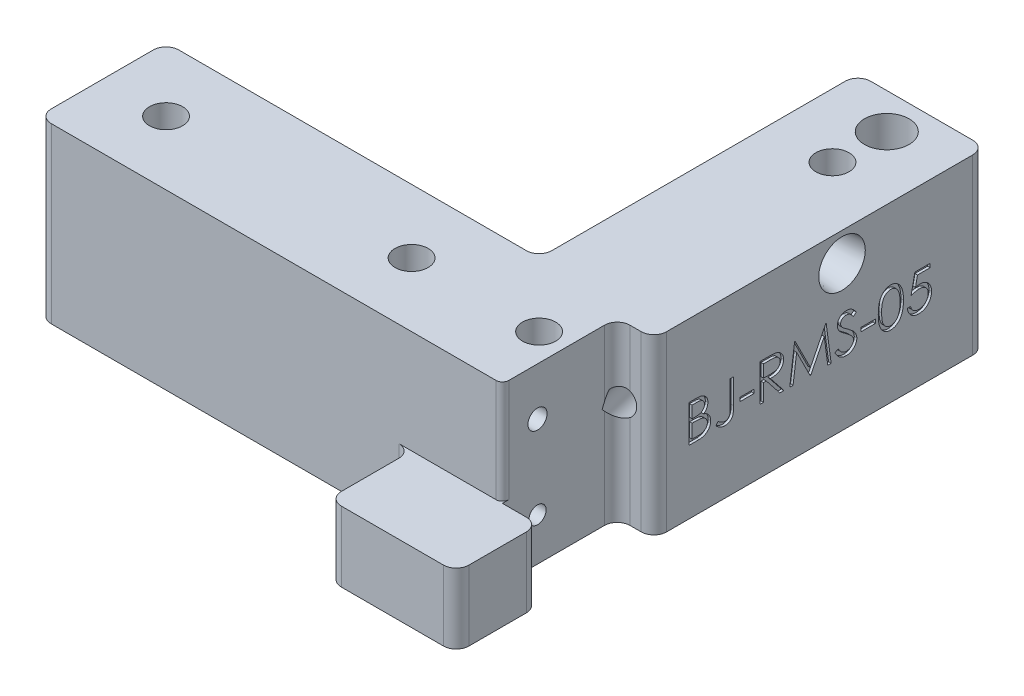
from build123d import *

# Parameters (mm, degrees)
SKETCH1_R                        = 2.6
BOSS_EXTRUDE1_DEPTH              = 10
SKETCH4_R                        = 2.6
MOTOR_TENSIONING_HOLE_DEPTH      = 106.651549918
SKETCH10_W                       = 20
SKETCH10_H                       = 13
BOSS_EXTRUDE3_DEPTH              = 10
FILLET1_R                        = 2
CHAMFER2_SIZE                    = 12
CHAMFER2_SIZE2                   = 1.049863962
SKETCH6_R                        = 3.5
CUT_EXTRUDE1_DEPTH               = 5
SKETCH2_R                        = 2.6
HEIGHT_BUMP_DEPTH                = 10.2
SKETCH12_W                       = 18
SKETCH12_H                       = 20.2
LIMIT_SWITCH_CUTOUT_DEPTH        = 5.75
SKETCH8_W                        = 2.238782052
SKETCH8_H                        = 0.597008547
SKETCH8_W_2                      = 2.238782051
RIGHT_SIDE_PART_NUM_SHORT_DEPTH  = 0.4
SKETCH11_W                       = 22.169940191
SKETCH11_H                       = 13
CUT_EXTRUDE4_DEPTH               = 12.2
FILLET2_R                        = 2
FILLET3_R                        = 1
MOVE_FACE2_BY                    = 7
CUT_EXTRUDE8_DEPTH               = 4
CUT_SWEEP1_START                 = 17.571186692
CUT_SWEEP1_OUTLINE_R             = 2
CUT_SWEEP1_DEPTH                 = 38.261414041
SKETCH22_R                       = 1.5
SKETCH22_R_2                     = 1.35
D2HW_LIMIT_SWITCH_MOUNTING_DEPTH = 7


# Read off the part's stored shape, not the designer's step: Cut-Sweep1
with BuildPart() as part:
    # Sketch1 → Boss-Extrude1 (new body)
    with BuildSketch(Plane(origin=(0, 0, 0), x_dir=(1, 0, 0), z_dir=(0, 1, 0))):
        Polygon((0, 0), (78.5, 0), (78.5, 20), (20, 20), (20, 70), (0, 70), align=None)
        with Locations(Location((10, 56, 0), (0, 0, 270))):
            Circle(SKETCH1_R, mode=Mode.SUBTRACT)
        with Locations(Location((68.5, 10, 0), (0, 0, 270))):
            Circle(SKETCH1_R, mode=Mode.SUBTRACT)
        with Locations(Location((10, 10, 0), (0, 0, 270))):
            Circle(SKETCH1_R, mode=Mode.SUBTRACT)
        with Locations(Location((30, 10, 0), (0, 0, 270))):
            Circle(SKETCH1_R, mode=Mode.SUBTRACT)
    extrude(amount=BOSS_EXTRUDE1_DEPTH)

    # Sketch4 → motor tensioning hole (cut, through all)
    with BuildSketch(Plane.ZY):
        with Locations((-47.5, 5.5)):
            Circle(SKETCH4_R)
    extrude(amount=-MOTOR_TENSIONING_HOLE_DEPTH, mode=Mode.SUBTRACT)

    # Sketch10 → Boss-Extrude3 (add)
    with BuildSketch(Plane(origin=(0, 10, 0), x_dir=(1, 0, 0), z_dir=(0, 1, 0))):
        with Locations((10, -6.5)):
            Rectangle(SKETCH10_W, SKETCH10_H)
    extrude(amount=-BOSS_EXTRUDE3_DEPTH)

    # Fillet1
    fillet1_edges = [part.edges().sort_by_distance(p)[0] for p in [
        (0, 5, -70),
        (20, 5, -70),
        (20, 5, -20),
        (78.5, 5, -20),
        (78.5, 5, 0),
        (0, 5, 13),
        (20, 5, 0),
        (20, 5, 13),
    ]]
    fillet(fillet1_edges, radius=FILLET1_R)

    # Chamfer2
    chamfer2_edges = [part.edges().sort_by_distance(p)[0] for p in [
        (0, 5.5, -50.1),
    ]]
    chamfer2_side = [part.faces().sort_by_distance(p)[0] for p in [
        (10, 5.5, -50.1),
    ]]
    chamfer(chamfer2_edges, length=CHAMFER2_SIZE, length2=CHAMFER2_SIZE2, reference=chamfer2_side[0])

    # Sketch6 → Cut-Extrude1 (cut)
    with BuildSketch(Plane(origin=(0, 10, 0), x_dir=(1, 0, 0), z_dir=(0, 1, 0))):
        with Locations(Location((9.89945477, 64.41665231, 0), (0, 0, 270))):
            Circle(SKETCH6_R)
    extrude(amount=-CUT_EXTRUDE1_DEPTH, mode=Mode.SUBTRACT)


with BuildPart() as body_2:
    # Mirror1: mirrored copy
    add(part.part.mirror(Plane(origin=(78.5, 10, 0), x_dir=(0, 0, 1), z_dir=(-1, 0, 0))))

    # Sketch2 → height bump (add)
    with BuildSketch(Plane(origin=(0, 0, 0), x_dir=(1, 0, 0), z_dir=(0, 1, 0))):
        with BuildLine():
            Line((157, -11), (157, 68))
            ThreePointArc((157, 68), (156.414213562, 69.414213562), (155, 70))
            Line((155, 70), (139, 70))
            ThreePointArc((139, 70), (137.585786438, 69.414213562), (137, 68))
            Line((137, 68), (137, 22))
            ThreePointArc((137, 22), (136.414213562, 20.585786438), (135, 20))
            Line((135, 20), (80.5, 20))
            ThreePointArc((80.5, 20), (79.085786438, 19.414213562), (78.5, 18))
            Line((78.5, 18), (78.5, 2))
            ThreePointArc((78.5, 2), (79.085786438, 0.585786438), (80.5, 0))
            Line((80.5, 0), (135, 0))
            ThreePointArc((135, 0), (136.414213562, -0.585786438), (137, -2))
            Line((137, -2), (137, -11))
            ThreePointArc((137, -11), (137.585786438, -12.414213562), (139, -13))
            Line((139, -13), (155, -13))
            ThreePointArc((155, -13), (156.414213562, -12.414213562), (157, -11))
        make_face()
        with Locations(Location((147, 56, 0), (0, 0, 270))):
            Circle(SKETCH2_R, mode=Mode.SUBTRACT)
        with Locations(Location((147, 10, 0), (0, 0, 270))):
            Circle(SKETCH2_R, mode=Mode.SUBTRACT)
        with Locations(Location((88.5, 10, 0), (0, 0, 270))):
            Circle(SKETCH2_R, mode=Mode.SUBTRACT)
        with Locations(Location((127, 10, 0), (0, 0, 270))):
            Circle(SKETCH2_R, mode=Mode.SUBTRACT)
    extrude(amount=-HEIGHT_BUMP_DEPTH)

    # Sketch12 → Limit Switch Cutout (cut)
    with BuildSketch(Plane(origin=(157, 0, 0), x_dir=(0, 0, -1), z_dir=(1, 0, 0))):
        with Locations((9, -0.1)):
            Rectangle(SKETCH12_W, SKETCH12_H)
    extrude(amount=-LIMIT_SWITCH_CUTOUT_DEPTH, mode=Mode.SUBTRACT)

    # Sketch8 → Right Side Part Num Short (cut)
    # profile 1 of 9: a face of its own
    with BuildSketch(Plane(origin=(157, 0, 0), x_dir=(0, 0, -1), z_dir=(1, 0, 0))):
        with BuildLine():
            Line((23.479347008, -1.379166667), (24.615062486, -1.379166667))
            add(Edge.make_bspline(
                [(24.615062486, -1.379166667), (24.670657229, -1.379458956), (24.778413677, -1.380025486), (24.935109582, -1.388811837), (25.081875759, -1.400792226), (25.218754771, -1.419801558), (25.345683367, -1.442738597), (25.463044069, -1.470515308), (25.570463677, -1.503821474), (25.698709501, -1.556784873), (25.844929934, -1.635487809), (26.003253927, -1.751785672), (26.13863693, -1.894034304), (26.25536346, -2.054494149), (26.348166037, -2.231008046), (26.415304023, -2.419368863), (26.457809204, -2.617147046), (26.46218054, -2.752927426), (26.464389743, -2.821548644)],
                knots=[0, 0, 0, 0, 1.001505555, 1.941167018, 2.826882275, 3.653841531, 4.429895133, 5.150066043, 5.825578002, 6.45369114, 7.647487171, 8.808567382, 9.977351308, 11.170798116, 12.373658725, 13.556498008, 14.765093433, 16, 16, 16, 16], degree=3))
            add(Edge.make_bspline(
                [(26.464389743, -2.821548644), (26.462571617, -2.885831526), (26.458998827, -3.01215345), (26.424834262, -3.196913534), (26.371348007, -3.372787882), (26.29699892, -3.539134635), (26.200369767, -3.692195299), (26.085851825, -3.833204597), (25.94768719, -3.956192248), (25.844170754, -4.024949432), (25.791589095, -4.059874967)],
                knots=[0, 0, 0, 0, 1.044552857, 2.05264487, 3.044412934, 4.028983338, 5.005914585, 5.980388656, 6.974128949, 8, 8, 8, 8], degree=3))
            add(Edge.make_bspline(
                [(25.791589095, -4.059874967), (25.857714473, -4.085262114), (25.984228701, -4.133834015), (26.15833151, -4.219708709), (26.308334127, -4.313111647), (26.435389857, -4.415112355), (26.5440526, -4.525057604), (26.638937075, -4.644559502), (26.719898837, -4.775176936), (26.789271401, -4.915548054), (26.843403082, -5.064239526), (26.883942533, -5.219856638), (26.907171731, -5.381841374), (26.910477368, -5.492080273), (26.912146153, -5.547732205)],
                knots=[0, 0, 0, 0, 1.27268992, 2.434971085, 3.483601985, 4.442670788, 5.356604649, 6.2567628, 7.179492994, 8.113709626, 9.066344395, 10.018646069, 10.999752585, 12, 12, 12, 12], degree=3))
            add(Edge.make_bspline(
                [(26.912146153, -5.547732205), (26.910521565, -5.604554967), (26.907325143, -5.716355344), (26.883742499, -5.880594538), (26.843813068, -6.037549062), (26.788812602, -6.18823411), (26.717029562, -6.332358167), (26.629670555, -6.470084512), (26.525508299, -6.600029345), (26.408987076, -6.723636609), (26.277166579, -6.834777584), (26.134945734, -6.933757872), (25.980533462, -7.015159835), (25.8164658, -7.083539695), (25.640902289, -7.135772857), (25.454631286, -7.17231534), (25.257813441, -7.196937526), (25.122753891, -7.198961854), (25.053490638, -7.2)],
                knots=[0, 0, 0, 0, 0.978564426, 1.925352924, 2.850884081, 3.763762016, 4.682927383, 5.618979971, 6.567305752, 7.547517671, 8.540179244, 9.531824382, 10.526200242, 11.540722885, 12.589160233, 13.674978461, 14.80764778, 16, 16, 16, 16], degree=3))
            Line((25.053490638, -7.2), (23.479347008, -7.2))
            Line((23.479347008, -7.2), (23.479347008, -1.379166667))
        make_face()
        with BuildLine():
            Line((24.001729487, -1.976175214), (24.001729487, -3.841826923))
            Line((24.001729487, -3.841826923), (24.352705214, -3.841826923))
            add(Edge.make_bspline(
                [(24.352705214, -3.841826923), (24.404009699, -3.841161813), (24.503140419, -3.839876685), (24.646698628, -3.836195395), (24.779954164, -3.825887459), (24.90267701, -3.815582485), (25.014673908, -3.798827486), (25.115696735, -3.778883444), (25.207330949, -3.757790564), (25.313003265, -3.721918453), (25.432867442, -3.668902844), (25.560648212, -3.586626469), (25.673297085, -3.488629657), (25.768421456, -3.375554213), (25.84627339, -3.251044615), (25.900346795, -3.117087482), (25.937013528, -2.977021382), (25.940325634, -2.880864121), (25.942007264, -2.832042935)],
                knots=[0, 0, 0, 0, 1.156816544, 2.235205308, 3.236616184, 4.169592532, 5.011045266, 5.787822928, 6.49130361, 7.128639758, 8.301311294, 9.436451833, 10.541879658, 11.654887649, 12.756523258, 13.837046038, 14.901820046, 16, 16, 16, 16], degree=3))
            add(Edge.make_bspline(
                [(25.942007264, -2.832042935), (25.941132177, -2.799736027), (25.939415596, -2.736362499), (25.925356949, -2.643978633), (25.901462305, -2.557092297), (25.870771057, -2.474512782), (25.827882012, -2.398822241), (25.777384681, -2.327403617), (25.716372884, -2.262689058), (25.646926496, -2.202203118), (25.567083584, -2.148577398), (25.476891781, -2.101610319), (25.375130846, -2.063790241), (25.263515777, -2.030667783), (25.140328504, -2.007403918), (25.006990586, -1.988023225), (24.862409869, -1.97815651), (24.762382835, -1.976850376), (24.710677136, -1.976175214)],
                knots=[0, 0, 0, 0, 0.91205012, 1.789085906, 2.630437955, 3.453916878, 4.269457761, 5.079663411, 5.91843418, 6.774407191, 7.675494373, 8.627863946, 9.638891023, 10.736472738, 11.911756761, 13.175263542, 14.539845004, 16, 16, 16, 16], degree=3))
            Line((24.710677136, -1.976175214), (24.001729487, -1.976175214))
        make_face(mode=Mode.SUBTRACT)
        with BuildLine():
            Line((24.001729487, -4.43883547), (24.001729487, -6.602991453))
            Line((24.001729487, -6.602991453), (24.745658106, -6.602991453))
            add(Edge.make_bspline(
                [(24.745658106, -6.602991453), (24.798908629, -6.602353245), (24.901541992, -6.601123182), (25.049725824, -6.597107548), (25.187069391, -6.58797337), (25.312945969, -6.573594499), (25.428714781, -6.557997245), (25.532987032, -6.537023483), (25.626607974, -6.512993486), (25.735165365, -6.47584963), (25.857408699, -6.418146095), (25.989143897, -6.331142554), (26.106269405, -6.227492958), (26.205731247, -6.107532378), (26.287244515, -5.977093611), (26.346542933, -5.838814976), (26.383115822, -5.694981307), (26.387543263, -5.596914048), (26.389763675, -5.547732205)],
                knots=[0, 0, 0, 0, 1.160039823, 2.235823828, 3.228722157, 4.157150951, 4.99529583, 5.772374946, 6.472645482, 7.099169577, 8.269452708, 9.405989375, 10.527446681, 11.663510218, 12.788923519, 13.866172445, 14.929861265, 16, 16, 16, 16], degree=3))
            add(Edge.make_bspline(
                [(26.389763675, -5.547732205), (26.389304487, -5.516976018), (26.388393518, -5.455959745), (26.374655329, -5.366292603), (26.354675119, -5.279436002), (26.328844865, -5.195154093), (26.291226537, -5.114970656), (26.247309938, -5.037299852), (26.195818178, -4.962039006), (26.115583536, -4.86688958), (25.998880843, -4.757263309), (25.833058979, -4.649931297), (25.64451005, -4.563370837), (25.507757898, -4.526617303), (25.437115271, -4.507631377)],
                knots=[0, 0, 0, 0, 0.723448775, 1.435228256, 2.130040452, 2.821711965, 3.505591119, 4.210454504, 4.921174351, 5.648778258, 7.137944449, 8.670945889, 10.280296675, 12, 12, 12, 12], degree=3))
            add(Edge.make_bspline(
                [(25.437115271, -4.507631377), (25.408794262, -4.501885243), (25.347388475, -4.48942644), (25.247257535, -4.476275176), (25.132943238, -4.464558571), (25.00418162, -4.455891919), (24.86080977, -4.446933584), (24.70252149, -4.443449697), (24.529963194, -4.43929319), (24.410233022, -4.438991946), (24.348041085, -4.43883547)],
                knots=[0, 0, 0, 0, 0.634451884, 1.375622551, 2.216452059, 3.157844607, 4.20941857, 5.370758133, 6.634282058, 8, 8, 8, 8], degree=3))
            Line((24.348041085, -4.43883547), (24.001729487, -4.43883547))
        make_face(mode=Mode.SUBTRACT)
    # profile 2 of 9: a face of its own
    with BuildSketch(Plane(origin=(157, 0, 0), x_dir=(0, 0, -1), z_dir=(1, 0, 0))):
        with BuildLine():
            Line((29.971814957, -1.379166667), (30.494197435, -1.379166667))
            Line((30.494197435, -1.379166667), (30.494197435, -5.309861612))
            add(Edge.make_bspline(
                [(30.494197435, -5.309861612), (30.493675359, -5.382547474), (30.492672908, -5.522113197), (30.487160728, -5.723137998), (30.47696017, -5.906694961), (30.462100393, -6.073201473), (30.442275911, -6.222135901), (30.419589582, -6.354649031), (30.392127225, -6.469634908), (30.350771923, -6.598749898), (30.282960963, -6.740352154), (30.180901734, -6.893282327), (30.054119334, -7.027050749), (29.907266306, -7.143222484), (29.73905915, -7.23578576), (29.552961755, -7.302235027), (29.350119704, -7.342766082), (29.209423157, -7.347046732), (29.136935817, -7.349252137)],
                knots=[0, 0, 0, 0, 1.237770943, 2.376671248, 3.424123796, 4.367912054, 5.222547132, 5.982086412, 6.656319012, 7.234008312, 8.288027371, 9.317870876, 10.352700517, 11.413286737, 12.494591526, 13.606319346, 14.766767577, 16, 16, 16, 16], degree=3))
            add(Edge.make_bspline(
                [(29.136935817, -7.349252137), (29.080459833, -7.347454981), (28.966826413, -7.343838984), (28.797705079, -7.314366088), (28.629063936, -7.268936906), (28.460007895, -7.20240878), (28.287196931, -7.111927088), (28.108290547, -6.993539959), (27.920987455, -6.847467765), (27.797613585, -6.73597761), (27.733032905, -6.677617521)],
                knots=[0, 0, 0, 0, 0.848567217, 1.707373443, 2.573483905, 3.470863513, 4.432650262, 5.500696352, 6.691726801, 8, 8, 8, 8], degree=3))
            Line((27.733032905, -6.677617521), (28.040865437, -6.229861111))
            add(Edge.make_bspline(
                [(28.040865437, -6.229861111), (28.11188406, -6.278834935), (28.245976478, -6.371303902), (28.44306065, -6.49025945), (28.617680915, -6.592249041), (28.731907198, -6.644224558), (28.784794057, -6.668289263)],
                knots=[0, 0, 0, 0, 1.196737151, 2.259595785, 3.194191475, 4, 4, 4, 4], degree=3))
            add(Edge.make_bspline(
                [(28.784794057, -6.668289263), (28.816865703, -6.68086136), (28.879765344, -6.705518043), (28.975933959, -6.733035448), (29.071553681, -6.748073837), (29.134947036, -6.750870054), (29.166086625, -6.75224359)],
                knots=[0, 0, 0, 0, 1.051806502, 2.062826769, 3.048436908, 4, 4, 4, 4], degree=3))
            add(Edge.make_bspline(
                [(29.166086625, -6.75224359), (29.206304905, -6.750542684), (29.285801616, -6.747180621), (29.401326854, -6.717495576), (29.511852889, -6.672185539), (29.613417546, -6.605842519), (29.707025505, -6.526959549), (29.784264347, -6.431571044), (29.848654812, -6.325854758), (29.887404421, -6.2257839), (29.912092691, -6.134518838), (29.927761754, -6.05064373), (29.941463431, -5.952585175), (29.953407035, -5.840226128), (29.96039947, -5.713341637), (29.968244744, -5.572304271), (29.971080756, -5.416758445), (29.971562755, -5.308306422), (29.971814957, -5.251559996)],
                knots=[0, 0, 0, 0, 0.997221856, 1.971139923, 2.944579524, 3.951425367, 4.971190333, 5.972282193, 6.985401279, 8.033996657, 8.624075553, 9.332086008, 10.151144245, 11.082816738, 12.137127781, 13.306538797, 14.590673636, 16, 16, 16, 16], degree=3))
            Line((29.971814957, -5.251559996), (29.971814957, -1.379166667))
        make_face()
    # profile 3 of 9: a face of its own
    with BuildSketch(Plane(origin=(157, 0, 0), x_dir=(0, 0, -1), z_dir=(1, 0, 0))):
        with Locations((32.58372735, -4.961217948)):
            Rectangle(SKETCH8_W, SKETCH8_H)
    # profile 4 of 9: a face of its own
    with BuildSketch(Plane(origin=(157, 0, 0), x_dir=(0, 0, -1), z_dir=(1, 0, 0))):
        with BuildLine():
            Line((34.673257264, -1.379166667), (35.83812355, -1.379166667))
            add(Edge.make_bspline(
                [(35.83812355, -1.379166667), (35.915858499, -1.379425421), (36.06511821, -1.379922258), (36.278947804, -1.38269258), (36.473242393, -1.390632789), (36.647900387, -1.397465754), (36.802918584, -1.409925566), (36.938772328, -1.421834404), (37.054835915, -1.437423695), (37.12509479, -1.451901642), (37.156906103, -1.458456864)],
                knots=[0, 0, 0, 0, 1.410062039, 2.707475311, 3.878576406, 4.937260626, 5.877586885, 6.699081471, 7.410979367, 8, 8, 8, 8], degree=3))
            add(Edge.make_bspline(
                [(37.156906103, -1.458456864), (37.199492357, -1.468978878), (37.283756386, -1.489798441), (37.405079294, -1.533803277), (37.520688235, -1.584726629), (37.630102978, -1.644537721), (37.732775479, -1.713680539), (37.829764384, -1.790961453), (37.921509803, -1.875957603), (38.004301395, -1.970811976), (38.082365509, -2.070325791), (38.148205165, -2.177934301), (38.204960751, -2.290461865), (38.250147908, -2.409052892), (38.286533062, -2.532557291), (38.312188367, -2.662093778), (38.327573973, -2.797072209), (38.329140368, -2.889137684), (38.329934615, -2.935819812)],
                knots=[0, 0, 0, 0, 1.027469482, 2.033020251, 3.019912614, 3.986113645, 4.951240523, 5.91722682, 6.890402269, 7.87763091, 8.8651537, 9.85103654, 10.82876324, 11.815024772, 12.821070561, 13.842952187, 14.906261191, 16, 16, 16, 16], degree=3))
            add(Edge.make_bspline(
                [(38.329934615, -2.935819812), (38.327491531, -3.013378432), (38.322724442, -3.164715389), (38.278278049, -3.384345212), (38.205473528, -3.589220774), (38.105150153, -3.779084114), (37.977392049, -3.950234318), (37.823847128, -4.100562254), (37.644429734, -4.226358632), (37.477406217, -4.313592642), (37.329866054, -4.369460848), (37.208404699, -4.408770364), (37.075910928, -4.439141752), (36.933654194, -4.466350209), (36.781042496, -4.486892253), (36.618441609, -4.501937601), (36.445735569, -4.511340823), (36.327091902, -4.512741157), (36.266057411, -4.513461538)],
                knots=[0, 0, 0, 0, 1.260483769, 2.459530307, 3.627416485, 4.787058657, 5.939039949, 7.08810263, 8.267026773, 9.491475466, 10.141966685, 10.831826277, 11.566392101, 12.351337768, 13.187381173, 14.07005841, 15.007169909, 16, 16, 16, 16], degree=3))
            Line((36.266057411, -4.513461538), (38.404560683, -7.2))
            Line((38.404560683, -7.2), (37.758578779, -7.2))
            Line((37.758578779, -7.2), (35.620075507, -4.513461538))
            Line((35.620075507, -4.513461538), (35.195639743, -4.513461538))
            Line((35.195639743, -4.513461538), (35.195639743, -7.2))
            Line((35.195639743, -7.2), (34.673257264, -7.2))
            Line((34.673257264, -7.2), (34.673257264, -1.379166667))
        make_face()
        with BuildLine():
            Line((35.195639743, -1.976175214), (35.195639743, -3.916452991))
            Line((35.195639743, -3.916452991), (36.261393282, -3.924615218))
            add(Edge.make_bspline(
                [(36.261393282, -3.924615218), (36.311153156, -3.924637231), (36.407601965, -3.924679901), (36.547136761, -3.91803787), (36.677057947, -3.910481899), (36.796868579, -3.898924476), (36.90662218, -3.884029676), (37.006263892, -3.865398046), (37.095956367, -3.843691223), (37.200562627, -3.810093995), (37.317372668, -3.756864938), (37.444319155, -3.679422079), (37.552424234, -3.582016056), (37.643757869, -3.47063282), (37.717149316, -3.348168725), (37.768891626, -3.21609174), (37.801725188, -3.07773619), (37.80559778, -2.982643551), (37.807552136, -2.934653779)],
                knots=[0, 0, 0, 0, 1.146690395, 2.22261258, 3.21895312, 4.145990853, 4.996080663, 5.770904154, 6.481378293, 7.121626537, 8.300444488, 9.431385265, 10.535395872, 11.636531494, 12.74115979, 13.810798291, 14.895190096, 16, 16, 16, 16], degree=3))
            add(Edge.make_bspline(
                [(37.807552136, -2.934653779), (37.805552894, -2.887843347), (37.801591126, -2.79508215), (37.769245972, -2.659280594), (37.714547799, -2.531110916), (37.640835696, -2.411094505), (37.551029958, -2.302152228), (37.445726406, -2.208940474), (37.327804313, -2.13202321), (37.217588999, -2.08287146), (37.119076862, -2.052736419), (37.033544439, -2.031530019), (36.936899517, -2.014492491), (36.828672832, -2.000841704), (36.709326406, -1.98910866), (36.578256787, -1.981206), (36.436333594, -1.976526276), (36.337966615, -1.976294958), (36.287045993, -1.976175214)],
                knots=[0, 0, 0, 0, 1.101028733, 2.181837193, 3.264309656, 4.369019818, 5.486613113, 6.575447106, 7.666700264, 8.788928104, 9.402425223, 10.0903467, 10.862060571, 11.710948788, 12.657782767, 13.684531032, 14.801375019, 16, 16, 16, 16], degree=3))
            Line((36.287045993, -1.976175214), (35.195639743, -1.976175214))
        make_face(mode=Mode.SUBTRACT)
    # profile 5 of 9: a face of its own
    with BuildSketch(Plane(origin=(157, 0, 0), x_dir=(0, 0, -1), z_dir=(1, 0, 0))):
        Polygon((39.300073504, -7.2), (40.068488802, -1.379166667), (40.14311487, -1.379166667), (42.546307478, -6.155235043), (44.943669925, -1.379166667), (45.019462025, -1.379166667), (45.792541452, -7.2), (45.267826909, -7.2), (44.710463461, -3.011611912), (42.609273223, -7.2), (42.491503959, -7.2), (40.382151495, -3.002283654), (39.825954079, -7.2), align=None)
    # profile 6 of 9: a face of its own
    with BuildSketch(Plane(origin=(157, 0, 0), x_dir=(0, 0, -1), z_dir=(1, 0, 0))):
        with BuildLine():
            Line((46.389549999, -6.077110877), (46.881615638, -5.782104701))
            add(Edge.make_bspline(
                [(46.881615638, -5.782104701), (46.927381087, -5.85871416), (47.015065922, -6.005494928), (47.161337409, -6.203832407), (47.312900119, -6.372407327), (47.470876427, -6.510239018), (47.634302058, -6.618754131), (47.804243871, -6.695592843), (47.980129182, -6.743516554), (48.099828502, -6.749337531), (48.159587059, -6.75224359)],
                knots=[0, 0, 0, 0, 1.272034388, 2.437168799, 3.508375237, 4.49857839, 5.41946034, 6.295179144, 7.148887113, 8, 8, 8, 8], degree=3))
            add(Edge.make_bspline(
                [(48.159587059, -6.75224359), (48.21062223, -6.750822188), (48.311799578, -6.748004256), (48.460750118, -6.720927731), (48.605409139, -6.679330179), (48.742795171, -6.619756558), (48.87101252, -6.547680529), (48.983448893, -6.46062385), (49.080650346, -6.363156149), (49.160161457, -6.254418567), (49.221163849, -6.137474452), (49.268049943, -6.017438971), (49.294069191, -5.892426483), (49.297988696, -5.808256463), (49.299966666, -5.765780248)],
                knots=[0, 0, 0, 0, 1.095163259, 2.171163733, 3.241058638, 4.321873601, 5.38011039, 6.391990106, 7.366004449, 8.327778327, 9.272591725, 10.192022065, 11.087607919, 12, 12, 12, 12], degree=3))
            add(Edge.make_bspline(
                [(49.299966666, -5.765780248), (49.297514747, -5.71731624), (49.292530354, -5.618795993), (49.25040169, -5.473442046), (49.184128597, -5.329596665), (49.12298882, -5.240618965), (49.091246881, -5.194424412)],
                knots=[0, 0, 0, 0, 0.938893495, 1.908633276, 2.914225137, 4, 4, 4, 4], degree=3))
            add(Edge.make_bspline(
                [(49.091246881, -5.194424412), (49.065185157, -5.161084636), (49.010471828, -5.091091944), (48.916411298, -4.986906952), (48.80603813, -4.879440367), (48.683129479, -4.764588578), (48.54320814, -4.647693278), (48.390656547, -4.523180201), (48.221579868, -4.395784483), (48.103002014, -4.310347014), (48.041817795, -4.266262687)],
                knots=[0, 0, 0, 0, 0.722233717, 1.516239348, 2.393582979, 3.351407094, 4.387010283, 5.505090956, 6.712668013, 8, 8, 8, 8], degree=3))
            add(Edge.make_bspline(
                [(48.041817795, -4.266262687), (47.980575982, -4.222642048), (47.8634863, -4.139242707), (47.6997403, -4.015468035), (47.553313973, -3.9023046), (47.424858132, -3.798687094), (47.314429279, -3.704601464), (47.221157225, -3.620951201), (47.147417982, -3.545474017), (47.106413403, -3.496510262), (47.088003358, -3.474526743)],
                knots=[0, 0, 0, 0, 1.452282411, 2.77665338, 3.964542531, 5.026858415, 5.96415736, 6.766646006, 7.446254459, 8, 8, 8, 8], degree=3))
            add(Edge.make_bspline(
                [(47.088003358, -3.474526743), (47.062271042, -3.440265256), (47.011664988, -3.372885446), (46.944865096, -3.267570176), (46.888088417, -3.159762912), (46.84358011, -3.049173956), (46.806100232, -2.937355866), (46.780891149, -2.822849688), (46.765106052, -2.706169223), (46.763489546, -2.627648675), (46.762680341, -2.588342181)],
                knots=[0, 0, 0, 0, 1.068054152, 2.10047183, 3.106115577, 4.101338837, 5.06977816, 6.043150881, 7.020423561, 8, 8, 8, 8], degree=3))
            add(Edge.make_bspline(
                [(46.762680341, -2.588342181), (46.764851028, -2.526758139), (46.769146005, -2.404906371), (46.805468865, -2.226903907), (46.862800571, -2.056958163), (46.943119569, -1.896751644), (47.046659476, -1.75045584), (47.166478793, -1.616387933), (47.309191467, -1.503682327), (47.465776246, -1.405207035), (47.637168808, -1.328129347), (47.816767965, -1.269985907), (48.004859167, -1.237041225), (48.132257475, -1.232313437), (48.196900093, -1.22991453)],
                knots=[0, 0, 0, 0, 1.005424448, 1.989358655, 2.955360095, 3.929531133, 4.905563448, 5.876582895, 6.856512386, 7.866279853, 8.892233794, 9.918561126, 10.94386622, 12, 12, 12, 12], degree=3))
            add(Edge.make_bspline(
                [(48.196900093, -1.22991453), (48.26549296, -1.232280369), (48.401902279, -1.236985267), (48.602553415, -1.277893304), (48.795739749, -1.345582398), (48.951144798, -1.422398535), (49.072771546, -1.499119473), (49.165526912, -1.569002442), (49.259520815, -1.649454855), (49.355511437, -1.740691006), (49.451872272, -1.843548043), (49.550033894, -1.957321534), (49.650225851, -2.081316187), (49.714680537, -2.169833601), (49.747723076, -2.215211839)],
                knots=[0, 0, 0, 0, 1.286793592, 2.559021753, 3.825965368, 5.121522368, 5.803751409, 6.523245864, 7.299691795, 8.125521123, 9.008227632, 9.944561021, 10.946284179, 12, 12, 12, 12], degree=3))
            Line((49.747723076, -2.215211839), (49.275479987, -2.573183761))
            add(Edge.make_bspline(
                [(49.275479987, -2.573183761), (49.246964669, -2.536448165), (49.192050832, -2.465703996), (49.108680721, -2.366631225), (49.03010172, -2.276131437), (48.952683972, -2.197525028), (48.88051623, -2.126507313), (48.810471577, -2.065704956), (48.74355802, -2.014522209), (48.659210967, -1.959900241), (48.553242333, -1.905755675), (48.420220432, -1.859938935), (48.281208496, -1.83240629), (48.186529097, -1.828765961), (48.138598477, -1.826923077)],
                knots=[0, 0, 0, 0, 1.181633172, 2.275549214, 3.290209073, 4.226197932, 5.078386478, 5.862611352, 6.581680152, 7.217281963, 8.414376989, 9.595101626, 10.782541182, 12, 12, 12, 12], degree=3))
            add(Edge.make_bspline(
                [(48.138598477, -1.826923077), (48.078466737, -1.828938249), (47.96250834, -1.83282432), (47.79787815, -1.875266486), (47.649706468, -1.942092746), (47.522392261, -2.035749918), (47.416391598, -2.146713283), (47.339713829, -2.274403831), (47.293562663, -2.415405041), (47.287930957, -2.513763249), (47.28506282, -2.563855502)],
                knots=[0, 0, 0, 0, 1.14458467, 2.207223713, 3.21896685, 4.227309161, 5.202851033, 6.127160689, 7.046193047, 8, 8, 8, 8], degree=3))
            add(Edge.make_bspline(
                [(47.28506282, -2.563855502), (47.285716627, -2.595040997), (47.28702531, -2.657462981), (47.305277444, -2.749683976), (47.328725971, -2.841672002), (47.365883895, -2.933013488), (47.417182573, -3.025305892), (47.484546538, -3.120138472), (47.569386534, -3.218347088), (47.634375328, -3.282222208), (47.668687453, -3.315946347)],
                knots=[0, 0, 0, 0, 0.858281714, 1.717966888, 2.583508476, 3.4729293, 4.427298488, 5.488583878, 6.674047936, 8, 8, 8, 8], degree=3))
            add(Edge.make_bspline(
                [(47.668687453, -3.315946347), (47.681429045, -3.327316973), (47.711700151, -3.354330975), (47.767041184, -3.39855647), (47.840122243, -3.453110605), (47.929034975, -3.520611177), (48.03541879, -3.598912133), (48.159285385, -3.687012295), (48.299254029, -3.787771683), (48.398577263, -3.858216307), (48.451095138, -3.89546441)],
                knots=[0, 0, 0, 0, 0.420754252, 0.999615792, 1.744751191, 2.668019286, 3.750313428, 4.999500688, 6.413464383, 8, 8, 8, 8], degree=3))
            add(Edge.make_bspline(
                [(48.451095138, -3.89546441), (48.51426933, -3.941434623), (48.636597396, -4.03044957), (48.810652919, -4.164188505), (48.968470359, -4.294987234), (49.110603806, -4.422010469), (49.238457426, -4.54429469), (49.350612779, -4.663311075), (49.448212654, -4.778206961), (49.553285711, -4.92551159), (49.660651514, -5.106424894), (49.752856021, -5.328079297), (49.810995082, -5.550595321), (49.818597947, -5.700152214), (49.822349145, -5.773942475)],
                knots=[0, 0, 0, 0, 1.163667725, 2.253281268, 3.268753668, 4.215851969, 5.092017293, 5.902905408, 6.650798638, 7.335211899, 8.59617414, 9.77448103, 10.901945474, 12, 12, 12, 12], degree=3))
            add(Edge.make_bspline(
                [(49.822349145, -5.773942475), (49.821256261, -5.826127684), (49.819091718, -5.929484702), (49.794210293, -6.081250586), (49.757755803, -6.228652163), (49.702811736, -6.36986743), (49.635750484, -6.507479851), (49.550656141, -6.637879656), (49.452021813, -6.763952917), (49.338875182, -6.882337842), (49.215064556, -6.99101479), (49.084206079, -7.087688955), (48.946085565, -7.168296393), (48.801452298, -7.23407321), (48.650273055, -7.285518596), (48.492598681, -7.322793332), (48.328169268, -7.345670389), (48.216408467, -7.348044892), (48.159587059, -7.349252137)],
                knots=[0, 0, 0, 0, 0.983748083, 1.948392443, 2.894712957, 3.844097841, 4.80183111, 5.778335162, 6.776009319, 7.81870978, 8.863265674, 9.881300176, 10.883814829, 11.87499822, 12.874611388, 13.892143829, 14.928324115, 16, 16, 16, 16], degree=3))
            add(Edge.make_bspline(
                [(48.159587059, -7.349252137), (48.115622566, -7.348401993), (48.028247267, -7.346712412), (47.899008998, -7.331775688), (47.77238161, -7.310642564), (47.649954048, -7.277091165), (47.530148971, -7.236383621), (47.41348744, -7.186260703), (47.299912913, -7.126194357), (47.188788909, -7.057516799), (47.08039805, -6.977592192), (46.975756983, -6.884502937), (46.871432373, -6.780816425), (46.770503453, -6.663716952), (46.670928712, -6.535096355), (46.574671405, -6.393751248), (46.479739072, -6.24045153), (46.420174538, -6.132574715), (46.389549999, -6.077110877)],
                knots=[0, 0, 0, 0, 0.915332311, 1.819136955, 2.706846663, 3.586547465, 4.459518054, 5.340707479, 6.227863349, 7.133153174, 8.059268498, 9.028702269, 10.047606654, 11.120612155, 12.245963614, 13.433783089, 14.680604001, 16, 16, 16, 16], degree=3))
        make_face()
    # profile 7 of 9: a face of its own
    with BuildSketch(Plane(origin=(157, 0, 0), x_dir=(0, 0, -1), z_dir=(1, 0, 0))):
        with Locations((51.613374785, -4.961217948)):
            Rectangle(SKETCH8_W_2, SKETCH8_H)
    # profile 8 of 9: a face of its own
    with BuildSketch(Plane(origin=(157, 0, 0), x_dir=(0, 0, -1), z_dir=(1, 0, 0))):
        with BuildLine():
            add(Edge.make_bspline(
                [(53.180522222, -4.291915398), (53.181067747, -4.1986201), (53.182127438, -4.017392638), (53.193916157, -3.753318656), (53.213499673, -3.505583508), (53.240337661, -3.274175338), (53.272997492, -3.059034403), (53.316596343, -2.860735646), (53.366177873, -2.678361277), (53.423641881, -2.511316584), (53.488482288, -2.357351047), (53.559054505, -2.213617706), (53.638159288, -2.08033404), (53.721275654, -1.955372739), (53.811768111, -1.840779332), (53.907061456, -1.734935523), (54.010874982, -1.640287525), (54.119679675, -1.554062187), (54.234460628, -1.478475387), (54.35194611, -1.41189713), (54.47294478, -1.355019493), (54.597786991, -1.310298138), (54.72535065, -1.273359384), (54.856081689, -1.248098718), (54.990195957, -1.232204669), (55.080720617, -1.230685152), (55.126630161, -1.22991453)],
                knots=[0, 0, 0, 0, 1.646270934, 3.197905019, 4.663502075, 6.030701355, 7.308322542, 8.50163776, 9.611534131, 10.641858119, 11.616356847, 12.558055219, 13.465016945, 14.349605745, 15.204443733, 16.039544428, 16.859896111, 17.680448484, 18.487036065, 19.28249412, 20.06191084, 20.843045899, 21.620316918, 22.403196591, 23.190181807, 24, 24, 24, 24], degree=3))
            add(Edge.make_bspline(
                [(55.126630161, -1.22991453), (55.172923213, -1.230725813), (55.264985528, -1.2323392), (55.401093866, -1.247845804), (55.534057801, -1.273575755), (55.663310467, -1.310032424), (55.78991357, -1.355261424), (55.912876857, -1.411951546), (56.032964111, -1.477941282), (56.148266982, -1.55548123), (56.260051289, -1.641932706), (56.365571294, -1.739660621), (56.464836602, -1.84767819), (56.559093033, -1.964829718), (56.645666448, -2.093362174), (56.728111787, -2.231040033), (56.801906709, -2.380271007), (56.872978544, -2.53856519), (56.934325116, -2.710302489), (56.98965005, -2.894514835), (57.034352335, -3.093378096), (57.071587827, -3.305848899), (57.100434041, -3.532707535), (57.121443328, -3.773467705), (57.132541303, -4.028287807), (57.134631317, -4.202510087), (57.135703846, -4.291915398)],
                knots=[0, 0, 0, 0, 0.810914788, 1.612654377, 2.396697861, 3.181598691, 3.963628158, 4.749916497, 5.551656086, 6.361998678, 7.18212741, 8.025565596, 8.878627764, 9.750805457, 10.657531673, 11.591944965, 12.560506719, 13.57287815, 14.630710178, 15.753379473, 16.941251878, 18.199788006, 19.531962791, 20.947069417, 22.433333509, 24, 24, 24, 24], degree=3))
            add(Edge.make_bspline(
                [(57.135703846, -4.291915398), (57.134620198, -4.380930754), (57.132508756, -4.554373546), (57.12156774, -4.808047085), (57.100016302, -5.047529545), (57.073057548, -5.273395278), (57.035719458, -5.484704199), (56.989809438, -5.682187526), (56.938835032, -5.866698083), (56.875912166, -6.036724312), (56.807042211, -6.19463807), (56.732111129, -6.342099982), (56.651833811, -6.480413447), (56.564373719, -6.60847136), (56.471151555, -6.727180865), (56.370172089, -6.834446554), (56.264281843, -6.932853016), (56.152168575, -7.020417687), (56.035067459, -7.097061106), (55.915392661, -7.165603665), (55.791020772, -7.220872802), (55.664770302, -7.268329292), (55.534835388, -7.30458552), (55.401377998, -7.329654777), (55.265076973, -7.347236768), (55.172938893, -7.348578021), (55.126630161, -7.349252137)],
                knots=[0, 0, 0, 0, 1.561518951, 3.042555995, 4.452378317, 5.7783523, 7.031515105, 8.214008947, 9.334062868, 10.386615937, 11.391082383, 12.354592575, 13.286541444, 14.194233754, 15.072674879, 15.931287219, 16.775624067, 17.606195743, 18.42308326, 19.229000347, 20.022332153, 20.807536673, 21.593273796, 22.3848459, 23.188221202, 24, 24, 24, 24], degree=3))
            add(Edge.make_bspline(
                [(55.126630161, -7.349252137), (55.080721891, -7.348476543), (54.990199742, -7.346947224), (54.856067077, -7.331124983), (54.725875918, -7.305687104), (54.598983824, -7.270069252), (54.474739774, -7.226471482), (54.354836783, -7.169670654), (54.237941671, -7.104254351), (54.12436631, -7.029755299), (54.016244894, -6.944402452), (53.912968999, -6.849998034), (53.817133104, -6.744186242), (53.727934495, -6.628637838), (53.643159732, -6.504415863), (53.565178239, -6.369824271), (53.493048378, -6.225396739), (53.427117477, -6.070200166), (53.368661902, -5.901969887), (53.317026607, -5.718781313), (53.276257228, -5.519017571), (53.241360575, -5.304283092), (53.213213714, -5.073655139), (53.193997771, -4.827008505), (53.182121084, -4.56449689), (53.181064901, -4.384433944), (53.180522222, -4.291915398)],
                knots=[0, 0, 0, 0, 0.810891512, 1.598919785, 2.382837074, 3.152667961, 3.926044502, 4.706494248, 5.493654104, 6.291793342, 7.103789334, 7.925228297, 8.761435821, 9.622817696, 10.50288917, 11.416980706, 12.369136599, 13.353924996, 14.394355917, 15.514179734, 16.714354668, 17.994756427, 19.357759367, 20.818452758, 22.365282078, 24, 24, 24, 24], degree=3))
        make_face()
        with BuildLine():
            add(Edge.make_bspline(
                [(53.7029047, -4.289583333), (53.703103352, -4.367330872), (53.703488896, -4.518223577), (53.713560935, -4.737491477), (53.727281856, -4.942002845), (53.744979347, -5.132017357), (53.771261155, -5.306891842), (53.80070923, -5.467829042), (53.836545755, -5.613977256), (53.878946398, -5.746339365), (53.927241182, -5.867161685), (53.979971053, -5.979588944), (54.036617279, -6.084949248), (54.100013056, -6.182296213), (54.16905656, -6.271947298), (54.242188278, -6.355489282), (54.322137564, -6.429990928), (54.432739622, -6.519343805), (54.57875352, -6.611677412), (54.762725873, -6.692081564), (54.951767332, -6.742610483), (55.080077209, -6.749036277), (55.144120646, -6.75224359)],
                knots=[0, 0, 0, 0, 1.459021318, 2.831673884, 4.118529203, 5.306027144, 6.411944654, 7.436330062, 8.375795394, 9.233974572, 10.042671642, 10.816086306, 11.563610507, 12.285937304, 12.993564865, 13.685989202, 14.367179055, 15.041617293, 16.353048772, 17.594441528, 18.799311195, 20, 20, 20, 20], degree=3))
            add(Edge.make_bspline(
                [(55.144120646, -6.75224359), (55.208578345, -6.749586328), (55.337360662, -6.744277291), (55.525512938, -6.693056058), (55.708171137, -6.615772788), (55.851316971, -6.524389853), (55.960220678, -6.437362858), (56.038248101, -6.363164448), (56.109864388, -6.280083083), (56.177788648, -6.190443421), (56.240086659, -6.092532873), (56.296736901, -5.986822257), (56.348431468, -5.873018017), (56.377883298, -5.793572391), (56.392941259, -5.752953893)],
                knots=[0, 0, 0, 0, 1.353760809, 2.704726607, 4.075137775, 5.516104923, 6.260822281, 7.007110065, 7.778089737, 8.566572457, 9.372053459, 10.217411131, 11.088608312, 12, 12, 12, 12], degree=3))
            add(Edge.make_bspline(
                [(56.392941259, -5.752953893), (56.410489854, -5.701015862), (56.446121027, -5.595559385), (56.492042037, -5.431971264), (56.528206707, -5.260335238), (56.560742447, -5.081677038), (56.582949851, -4.894679107), (56.600824488, -4.699920037), (56.611353023, -4.497252986), (56.612658139, -4.359557031), (56.613321367, -4.289583333)],
                knots=[0, 0, 0, 0, 0.884706709, 1.796334032, 2.740027952, 3.714592787, 4.726048262, 5.777819803, 6.87074269, 8, 8, 8, 8], degree=3))
            add(Edge.make_bspline(
                [(56.613321367, -4.289583333), (56.61240635, -4.219620954), (56.610616381, -4.082759583), (56.603774427, -3.882326371), (56.586106411, -3.691955583), (56.566483353, -3.510827094), (56.537550117, -3.339943555), (56.506354098, -3.177874417), (56.464442082, -3.026627505), (56.419671932, -2.883834844), (56.36843131, -2.751118755), (56.312026214, -2.62786047), (56.25178598, -2.513464922), (56.186356087, -2.408245973), (56.116513266, -2.311732327), (56.040414104, -2.225859078), (55.961077189, -2.14796474), (55.849953845, -2.059051396), (55.70447577, -1.968393254), (55.523455093, -1.884962818), (55.335075224, -1.837051884), (55.207726277, -1.830296911), (55.144120646, -1.826923077)],
                knots=[0, 0, 0, 0, 1.31362396, 2.569729283, 3.763502607, 4.902122613, 5.988968491, 7.01645872, 7.998833611, 8.933434873, 9.825090667, 10.667526885, 11.477055099, 12.250526234, 12.991942729, 13.710640831, 14.402115721, 15.076753259, 16.378508321, 17.609869233, 18.806226677, 20, 20, 20, 20], degree=3))
            add(Edge.make_bspline(
                [(55.144120646, -1.826923077), (55.079741244, -1.830301566), (54.950865158, -1.837064699), (54.760527309, -1.884784313), (54.578078525, -1.967960638), (54.432985149, -2.059351667), (54.321784304, -2.146395264), (54.243481301, -2.221877259), (54.170062012, -2.304443709), (54.102427753, -2.394919274), (54.039081648, -2.492152748), (53.980904893, -2.596909063), (53.928488572, -2.709719082), (53.880118218, -2.83048713), (53.837588236, -2.962837819), (53.802506966, -3.108806015), (53.770098141, -3.269231328), (53.747155295, -3.445052938), (53.726759501, -3.635115043), (53.713652069, -3.840136964), (53.703455204, -4.059772606), (53.703091877, -4.211445492), (53.7029047, -4.289583333)],
                knots=[0, 0, 0, 0, 1.207732386, 2.417664972, 3.655092373, 4.956220595, 5.625982001, 6.301752483, 6.994047911, 7.697131622, 8.419323945, 9.170223765, 9.943494443, 10.752040957, 11.610060368, 12.549350801, 13.567764191, 14.679664412, 15.874934091, 17.154273443, 18.533957287, 20, 20, 20, 20], degree=3))
        make_face(mode=Mode.SUBTRACT)
    # profile 9 of 9: a face of its own
    with BuildSketch(Plane(origin=(157, 0, 0), x_dir=(0, 0, -1), z_dir=(1, 0, 0))):
        with BuildLine():
            Line((61.314763675, -1.379166667), (61.314763675, -1.976175214))
            Line((61.314763675, -1.976175214), (59.334840798, -1.976175214))
            Line((59.334840798, -1.976175214), (59.021178104, -3.507175648))
            add(Edge.make_bspline(
                [(59.021178104, -3.507175648), (59.082805553, -3.490161731), (59.202198987, -3.457199959), (59.378420327, -3.420602267), (59.545714741, -3.398540571), (59.654273899, -3.395528189), (59.706805108, -3.394070513)],
                knots=[0, 0, 0, 0, 1.100273476, 2.13160584, 3.095893838, 4, 4, 4, 4], degree=3))
            add(Edge.make_bspline(
                [(59.706805108, -3.394070513), (59.771805089, -3.395477384), (59.899611293, -3.398243646), (60.08660797, -3.424806352), (60.265112794, -3.466616425), (60.43475245, -3.525025197), (60.59584077, -3.599714361), (60.746895655, -3.693013904), (60.89018447, -3.802002075), (61.023136617, -3.927308006), (61.143751449, -4.065214552), (61.249800363, -4.213492582), (61.339877909, -4.370701087), (61.412323593, -4.5383421), (61.470173253, -4.714562263), (61.508677226, -4.901215737), (61.534316681, -5.096543146), (61.537181174, -5.230097294), (61.53864188, -5.298201289)],
                knots=[0, 0, 0, 0, 1.052922333, 2.070308379, 3.05430497, 4.020497103, 4.973039431, 5.925935799, 6.892292201, 7.88610001, 8.88166317, 9.857072816, 10.836096531, 11.812156883, 12.81219415, 13.836441305, 14.89672472, 16, 16, 16, 16], degree=3))
            add(Edge.make_bspline(
                [(61.53864188, -5.298201289), (61.537535796, -5.345636458), (61.535338577, -5.43986575), (61.524164926, -5.579805569), (61.502651598, -5.716782805), (61.473767419, -5.850815628), (61.436277231, -5.981650286), (61.390892935, -6.109661268), (61.335352161, -6.234051822), (61.274430695, -6.355998937), (61.205833874, -6.472745741), (61.129699856, -6.581926257), (61.049263438, -6.68517833), (60.962713658, -6.781394598), (60.869246051, -6.869942808), (60.769992582, -6.951348462), (60.66574525, -7.026988245), (60.554891234, -7.09379178), (60.4399007, -7.155264696), (60.319113058, -7.205695626), (60.195277822, -7.250783017), (60.066612665, -7.286721719), (59.933409027, -7.31488217), (59.795447335, -7.334008764), (59.653451149, -7.347939577), (59.557199491, -7.348811633), (59.508579614, -7.349252137)],
                knots=[0, 0, 0, 0, 1.056347294, 2.098418968, 3.122841568, 4.141288669, 5.149314143, 6.15115421, 7.162517403, 8.180376062, 9.185164535, 10.17417709, 11.141909838, 12.097768115, 13.052685741, 14.0056014, 14.954263652, 15.917497458, 16.885230207, 17.854509472, 18.828990115, 19.81800267, 20.826176721, 21.857883937, 22.917946725, 24, 24, 24, 24], degree=3))
            add(Edge.make_bspline(
                [(59.508579614, -7.349252137), (59.45058053, -7.348103207), (59.336474184, -7.345842825), (59.169298907, -7.322196129), (59.008453307, -7.288328997), (58.855232175, -7.237377963), (58.708262347, -7.173536236), (58.569522422, -7.092849222), (58.43546734, -7.001413736), (58.311546726, -6.89351153), (58.196533523, -6.775571997), (58.093577103, -6.64758411), (58.001884714, -6.511660265), (57.922924699, -6.367140358), (57.855572633, -6.214404135), (57.802661277, -6.052879335), (57.759955728, -5.883409923), (57.741888825, -5.766737954), (57.732712393, -5.707478632)],
                knots=[0, 0, 0, 0, 1.0467383, 2.05933395, 3.04377827, 4.011590433, 4.970194871, 5.932262533, 6.905835911, 7.896367577, 8.894135286, 9.877477877, 10.858688626, 11.851381753, 12.8477658, 13.868841284, 14.917554742, 16, 16, 16, 16], degree=3))
            Line((57.732712393, -5.707478632), (58.255094871, -5.707478632))
            add(Edge.make_bspline(
                [(58.255094871, -5.707478632), (58.267948198, -5.762986852), (58.292653006, -5.869676731), (58.346879472, -6.019573736), (58.41318022, -6.153152254), (58.492018166, -6.272179287), (58.586066252, -6.375971393), (58.693384838, -6.468467864), (58.813705992, -6.551913883), (58.947407589, -6.621469128), (59.088459818, -6.680789662), (59.236088142, -6.720290992), (59.38627287, -6.748066168), (59.487852017, -6.750846465), (59.538896454, -6.75224359)],
                knots=[0, 0, 0, 0, 1.136247022, 2.183929868, 3.172523383, 4.106158343, 5.02341133, 5.958108904, 6.928429099, 7.938127109, 8.96079061, 9.975095812, 10.982467395, 12, 12, 12, 12], degree=3))
            add(Edge.make_bspline(
                [(59.538896454, -6.75224359), (59.5887202, -6.750878558), (59.686823564, -6.748190799), (59.831199168, -6.727503537), (59.97058796, -6.695642672), (60.103614552, -6.647961972), (60.232606779, -6.590011887), (60.354301728, -6.515646457), (60.472219966, -6.430063546), (60.582696278, -6.332013055), (60.683878077, -6.223962265), (60.773279626, -6.108414743), (60.847747897, -5.985151369), (60.910503314, -5.856306137), (60.958156479, -5.720466918), (60.992151777, -5.57827032), (61.012114007, -5.429365121), (61.014860077, -5.327801043), (61.016259401, -5.276046675)],
                knots=[0, 0, 0, 0, 1.027316725, 2.022795036, 3.002884548, 3.971462791, 4.93288096, 5.914575861, 6.907176829, 7.935150275, 8.956128384, 9.956726525, 10.942570165, 11.921478529, 12.907843606, 13.90538589, 14.932640048, 16, 16, 16, 16], degree=3))
            add(Edge.make_bspline(
                [(61.016259401, -5.276046675), (61.015164287, -5.229354026), (61.013020757, -5.137959809), (60.995507416, -5.004248272), (60.965044546, -4.877731558), (60.922762213, -4.757798719), (60.869078317, -4.644336636), (60.803475343, -4.537228214), (60.724722132, -4.43788516), (60.63476217, -4.346260997), (60.536210404, -4.261701127), (60.427371228, -4.189615783), (60.310522278, -4.128972816), (60.187071384, -4.076638537), (60.054082142, -4.039051345), (59.914188172, -4.010832136), (59.765878813, -3.994508253), (59.664478752, -3.992243303), (59.61235649, -3.99107906)],
                knots=[0, 0, 0, 0, 1.045622112, 2.046656509, 3.013763289, 3.955457236, 4.890082067, 5.820317437, 6.762574623, 7.722996705, 8.69280354, 9.665887285, 10.63943826, 11.638615906, 12.663482002, 13.728887084, 14.832589034, 16, 16, 16, 16], degree=3))
            add(Edge.make_bspline(
                [(59.61235649, -3.99107906), (59.567238498, -3.992044638), (59.47408129, -3.994038313), (59.331183446, -4.008717617), (59.181019711, -4.03239892), (59.024165723, -4.064972715), (58.860150426, -4.107599637), (58.689319942, -4.158680777), (58.51131509, -4.219752958), (58.391376446, -4.26587427), (58.32972094, -4.289583333)],
                knots=[0, 0, 0, 0, 0.817624296, 1.688186739, 2.600797293, 3.572016777, 4.590301741, 5.671205678, 6.80286297, 8, 8, 8, 8], degree=3))
            Line((58.32972094, -4.289583333), (58.926729487, -1.379166667))
            Line((58.926729487, -1.379166667), (61.314763675, -1.379166667))
        make_face()
    extrude(amount=-RIGHT_SIDE_PART_NUM_SHORT_DEPTH, mode=Mode.SUBTRACT)

    # Sketch11 → Cut-Extrude4 (cut)
    with BuildSketch(Plane(origin=(0, 10, 0), x_dir=(1, 0, 0), z_dir=(0, 1, 0))):
        with Locations((145.915029904, -6.5)):
            Rectangle(SKETCH11_W, SKETCH11_H)
    extrude(amount=-CUT_EXTRUDE4_DEPTH, mode=Mode.SUBTRACT)

    # Fillet2
    fillet2_edges = [body_2.edges().sort_by_distance(p)[0] for p in [
        (151.25, -0.1, -18),
        (157, -0.1, -18),
        (157, -6.2, 0),
    ]]
    fillet(fillet2_edges, radius=FILLET2_R)

    # Fillet3
    fillet3_edges = [body_2.edges().sort_by_distance(p)[0] for p in [
        (151.25, 3.9, 0),
    ]]
    fillet(fillet3_edges, radius=FILLET3_R)

    # Move Face2: a face moved outward by 7.0
    extrude(body_2.faces().sort_by_distance((117.75, -10.2, -7.75))[0], amount=MOVE_FACE2_BY, dir=(0, -1, 0))

    # Sketch15 → Cut-Extrude8 (cut)
    with BuildSketch(Plane(origin=(0, -2.2, 0), x_dir=(1, 0, 0), z_dir=(0, 1, 0))):
        with BuildLine():
            Line((157, -11), (157, -2))
            ThreePointArc((157, -2), (156.414213562, -0.585786438), (155, 0))
            Line((155, 0), (151.25, 0))
            Line((151.25, 0), (151.25, 1))
            ThreePointArc((151.25, 1), (150.957106781, 0.292893219), (150.25, 0))
            Line((150.25, 0), (135, 0))
            ThreePointArc((135, 0), (136.414213562, -0.585786438), (137, -2))
            Line((137, -2), (137, -11))
            ThreePointArc((137, -11), (137.585786438, -12.414213562), (139, -13))
            Line((139, -13), (155, -13))
            ThreePointArc((155, -13), (156.414213562, -12.414213562), (157, -11))
        make_face()
    extrude(amount=-CUT_EXTRUDE8_DEPTH, mode=Mode.SUBTRACT)

    # Cut-Sweep1 outline → Cut-Sweep1 (cut)
    with BuildSketch(Plane(origin=(0, 0, 0), x_dir=(0.8895310099059781, -0.17548716243870266, -0.4218279723238643), z_dir=(0.4568747994972479, 0.34167188254070896, 0.8212951614769428)).offset(CUT_SWEEP1_START)):
        with Locations((142.988950493, 6.020513827)):
            Circle(CUT_SWEEP1_OUTLINE_R)
    extrude(amount=CUT_SWEEP1_DEPTH, mode=Mode.SUBTRACT)

    # Sketch22 → D2HW Limit Switch Mounting (cut)
    with BuildSketch(Plane(origin=(151.25, 0, 0), x_dir=(0, 0, -1), z_dir=(1, 0, 0))):
        with Locations((5.5, 2.5)):
            Circle(SKETCH22_R)
        with Locations((5.5, -10.5)):
            Circle(SKETCH22_R_2)
    extrude(amount=-D2HW_LIMIT_SWITCH_MOUNTING_DEPTH, mode=Mode.SUBTRACT)


solid = body_2.part
